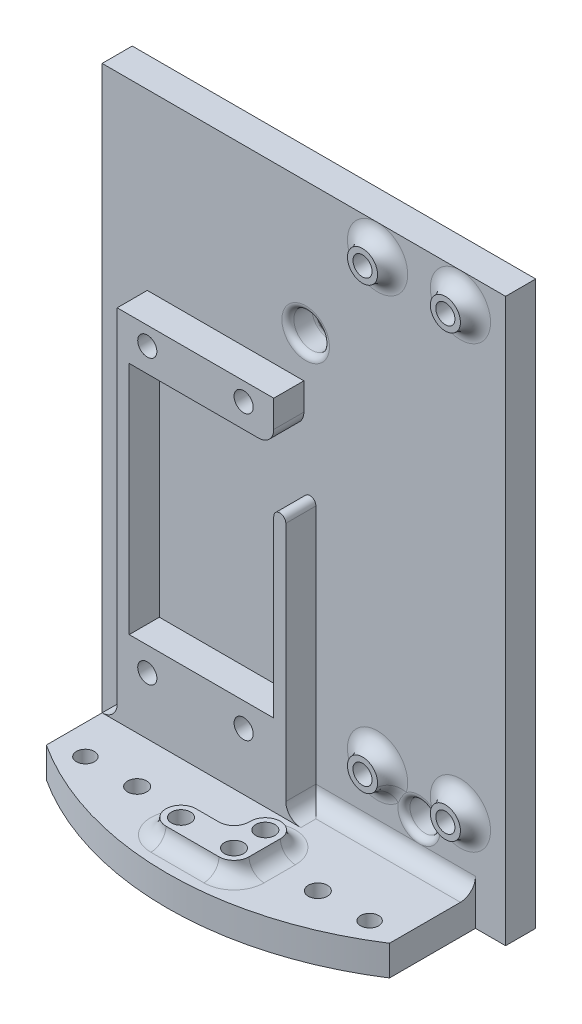
from build123d import *

# Parameters (mm, degrees)
SKETCH1_W                         = 85.09
SKETCH1_H                         = 118.618
BOSS1_MAIN_PLATE_DEPTH            = 6.35
BOSS2_BOTTOM_PLATE_DEPTH          = 6.35
BOSS3_BATTERY_PLATE_DEPTH         = 6.35
FILLET1_PLATE_CONVERGENCE_R       = 3.175
HOLES1_MAIN_PLATE_D               = 4.0386
HOLES2_TOP_MAIN_PLATE_D           = 7.493
HOLES3_BOT_MAIN_PLATE_D           = 6.35
FILLET1_HOLES_MAIN_PLATE_R        = 1.27
HOLES4_BOTTOM_PLATE_D             = 4.0386
HOLES6_D                          = 3.7973
BOSS4_BOTTOM_PLATE_STANDOFF_DEPTH = 3.175
HOLES7_BOTTOM_PLATE_D             = 4.0386
FILLET2_BOTTOM_PLATE_R            = 3.175
SKETCH21_R                        = 3.175
BOSS5_MAIN_PLATE_STANDOFFS_DEPTH  = 3.175
FILLET3_MAIN_PLATE_STANDOFFS_R    = 3.175
HOLES8_MAIN_PLATE_D               = 4.0386


with BuildPart() as part:
    # Sketch1 → Boss1 - Main Plate (new body)
    with BuildSketch(Plane.XY):
        with Locations((42.545, 59.309)):
            Rectangle(SKETCH1_W, SKETCH1_H)
    extrude(amount=BOSS1_MAIN_PLATE_DEPTH)

    # Sketch2 → Boss2 - Bottom Plate (add)
    with BuildSketch(Plane.XZ):
        with BuildLine():
            Line((6.35, 24.47393552), (6.35, 0))
            Line((6.35, 0), (78.74, 0))
            Line((78.74, 0), (78.74, 24.47393552))
            ThreePointArc((78.74, 24.47393552), (42.545, 35.1536), (6.35, 24.47393552))
        make_face()
    extrude(amount=-BOSS2_BOTTOM_PLATE_DEPTH)

    # Sketch3 → Boss3 - Battery Plate (add)
    with BuildSketch(Plane.XY.offset(6.35)):
        with BuildLine():
            Line((9.525, 6.35), (45.085, 6.35))
            Line((45.085, 6.35), (45.085, 23.495))
            Line((45.085, 23.495), (45.085, 60.325))
            ThreePointArc((45.085, 60.325), (43.815, 61.595), (42.545, 60.325))
            Line((42.545, 60.325), (42.545, 23.495))
            Line((42.545, 23.495), (12.065, 23.495))
            Line((12.065, 23.495), (12.065, 73.025))
            Line((12.065, 73.025), (39.37, 73.025))
            ThreePointArc((39.37, 73.025), (41.61506403, 73.95493597), (42.545, 76.2))
            Line((42.545, 76.2), (42.545, 81.915))
            Line((42.545, 81.915), (9.525, 81.915))
            Line((9.525, 81.915), (9.525, 73.025))
            Line((9.525, 73.025), (9.525, 23.495))
            Line((9.525, 23.495), (9.525, 6.35))
        make_face()
    extrude(amount=BOSS3_BATTERY_PLATE_DEPTH)

    # Fillet1 - Plate Convergence
    fillet1_plate_convergence_edges = [part.edges().sort_by_distance(p)[0] for p in [
        (61.9125, 6.35, 6.35),
        (7.9375, 6.35, 6.35),
        (9.525, 6.35, 9.525),
        (45.085, 6.35, 9.525),
    ]]
    fillet(fillet1_plate_convergence_edges, radius=FILLET1_PLATE_CONVERGENCE_R - 0.0001)  # a hair under: the kernel refuses the full size

    # Holes1 - Main Plate (through all)
    with Locations(Plane(origin=(0, 0, 0), x_dir=(-1, 0, 0), z_dir=(0, 0, -1))):
        with Locations((-36.195, 18.415), (-15.875, 18.415), (-15.875, 78.105), (-36.195, 78.105)):
            Hole(HOLES1_MAIN_PLATE_D / 2)

    # Holes2 - Top Main Plate (through all)
    with Locations(Plane(origin=(0, 0, 0), x_dir=(-1, 0, 0), z_dir=(0, 0, -1))):
        with Locations((-42.926, 90.805)):
            Hole(HOLES2_TOP_MAIN_PLATE_D / 2)

    # Holes3 - Bot Main Plate (through all)
    with Locations(Plane(origin=(0, 0, 0), x_dir=(-1, 0, 0), z_dir=(0, 0, -1))):
        with Locations((-66.8274, 13.97)):
            Hole(HOLES3_BOT_MAIN_PLATE_D / 2)

    # Fillet1 - Holes Main Plate
    fillet1_holes_main_plate_edges = [part.edges().sort_by_distance(p)[0] for p in [
        (39.1795, 90.805, 6.35),
        (39.1795, 90.805, 0),
        (63.6524, 13.97, 6.35),
        (63.6524, 13.97, 0),
    ]]
    fillet(fillet1_holes_main_plate_edges, radius=FILLET1_HOLES_MAIN_PLATE_R)

    # Holes4 - Bottom Plate (through all)
    with Locations(Plane(origin=(0, 0, 0), x_dir=(-1, 0, 0), z_dir=(0, -1, 0))):
        with Locations((-23.495, -22.4536), (-61.595, -22.4536)):
            Hole(HOLES4_BOTTOM_PLATE_D / 2)

    # Holes6 (through all)
    with Locations(Plane(origin=(0, 6.35, 0), x_dir=(1, 0, 0), z_dir=(0, 1, 0))):
        with Locations((72.517, -22.4536), (12.573, -22.4536)):
            Hole(HOLES6_D / 2)

    # Sketch17 → Boss4 - Bottom Plate Standoff (add)
    with BuildSketch(Plane(origin=(0, 6.35, 0), x_dir=(1, 0, 0), z_dir=(0, 1, 0))):
        with BuildLine():
            Line((36.957, -23.495), (41.783, -23.495))
            ThreePointArc((41.783, -23.495), (44.02806403, -22.56506403), (44.958, -20.32))
            Line((44.958, -20.32), (44.958, -20.066))
            ThreePointArc((44.958, -20.066), (48.133, -16.891), (51.308, -20.066))
            Line((51.308, -20.066), (51.308, -26.67))
            ThreePointArc((51.308, -26.67), (50.37806403, -28.91506403), (48.133, -29.845))
            Line((48.133, -29.845), (36.957, -29.845))
            ThreePointArc((36.957, -29.845), (33.782, -26.67), (36.957, -23.495))
        make_face()
    extrude(amount=BOSS4_BOTTOM_PLATE_STANDOFF_DEPTH)

    # Holes7 - Bottom Plate (through all)
    with Locations(Plane(origin=(0, 9.525, 0), x_dir=(1, 0, 0), z_dir=(0, 1, 0))):
        with Locations((36.957, -26.67), (48.133, -26.67), (48.133, -20.066)):
            Hole(HOLES7_BOTTOM_PLATE_D / 2)

    # Fillet2 - Bottom Plate
    fillet2_bottom_plate_edges = [part.edges().sort_by_distance(p)[0] for p in [
        (39.37, 6.35, 23.495),
        (44.02806403, 6.35, 22.56506403),
        (44.958, 6.35, 20.193),
        (48.133, 6.35, 16.891),
        (51.308, 6.35, 23.368),
        (50.37806403, 6.35, 28.91506403),
        (33.782, 6.35, 26.67),
        (42.545, 6.35, 29.845),
    ]]
    fillet(fillet2_bottom_plate_edges, radius=FILLET2_BOTTOM_PLATE_R - 0.0001)  # a hair under: the kernel refuses the full size

    # Sketch21 → Boss5 - Main Plate Standoffs (add)
    with BuildSketch(Plane.XY.offset(6.35)):
        with Locations((58.0898, 112.268)):
            Circle(SKETCH21_R)
        with Locations((75.565, 112.268)):
            Circle(SKETCH21_R)
        with Locations((58.0898, 19.4056)):
            Circle(SKETCH21_R)
        with Locations((75.565, 19.4056)):
            Circle(SKETCH21_R)
    extrude(amount=BOSS5_MAIN_PLATE_STANDOFFS_DEPTH)

    # Fillet3 - Main Plate Standoffs
    fillet3_main_plate_standoffs_edges = [part.edges().sort_by_distance(p)[0] for p in [
        (54.9148, 112.268, 6.35),
        (72.39, 112.268, 6.35),
        (54.9148, 19.4056, 6.35),
        (72.39, 19.4056, 6.35),
    ]]
    fillet(fillet3_main_plate_standoffs_edges, radius=FILLET3_MAIN_PLATE_STANDOFFS_R - 0.0001)  # a hair under: the kernel refuses the full size

    # Holes8 - Main Plate (through all)
    with Locations(Plane.XY.offset(9.525)):
        with Locations((58.0898, 112.268), (75.565, 112.268), (75.565, 19.4056), (58.0898, 19.4056)):
            Hole(HOLES8_MAIN_PLATE_D / 2)


solid = part.part
